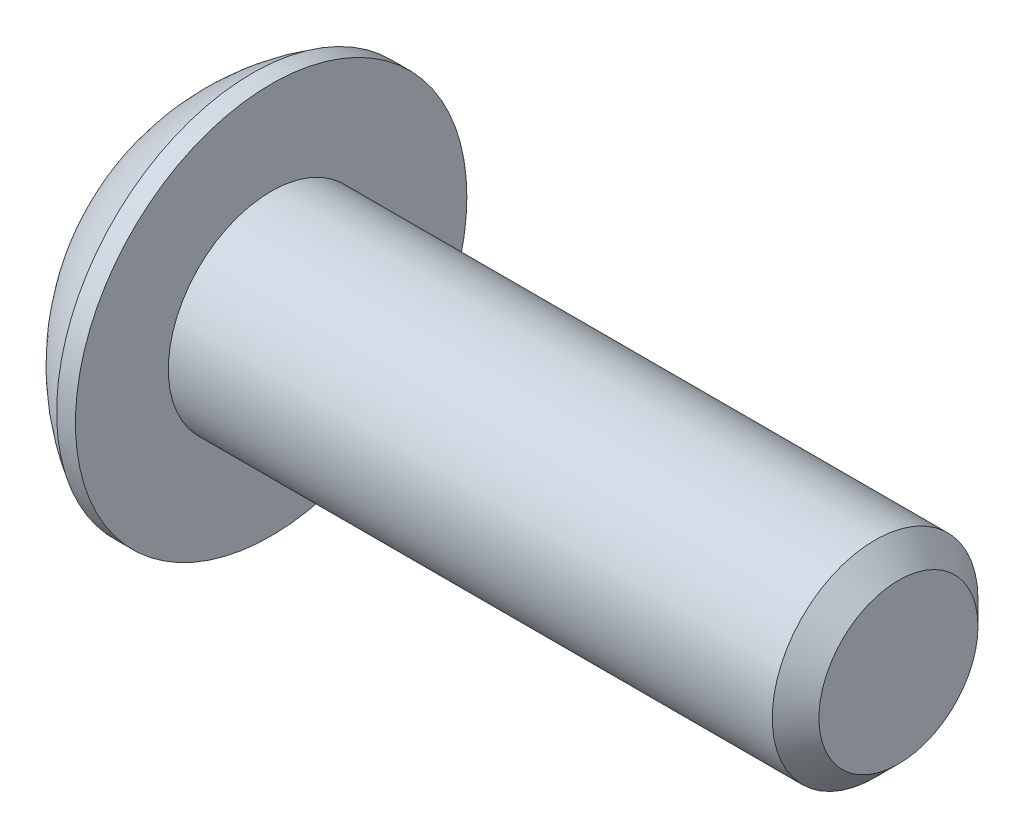
from build123d import *

# Parameters (mm, degrees)
CUT_EXTRUDE1_DEPTH = 1.3208
TAPPED_HOLE1_D     = 2.388
TAPPED_HOLE1_DEPTH = 1.32
TAPPED_HOLE1_TIP   = 0.689356221
CHAMFER1_SIZE      = 0.4724


with BuildPart() as part:
    # Sketch1 → Revolve2 (revolve)
    with BuildSketch(Plane.XY):
        with BuildLine():
            Line((7.4549, 0), (-7.4549, 0))
            Line((-7.4549, 0), (-7.4549, 1.9812))
            ThreePointArc((-7.4549, 1.9812), (-6.689453788, 3.109295804), (-5.6261, 3.9624))
            Line((-5.6261, 3.9624), (-5.2451, 3.9624))
            Line((-5.2451, 3.9624), (-5.2451, 2.0828))
            Line((-5.2451, 2.0828), (7.4549, 2.0828))
            Line((7.4549, 2.0828), (7.4549, 0))
        make_face()
    revolve(axis=Axis((7.4549, 0, 0), (-1, 0, 0)))

    # Sketch9 → Cut-Extrude1 (cut)
    with BuildSketch(Plane.ZY.offset(7.4549)):
        Polygon((0, 1.378481503), (1.1938, 0.689240751), (1.1938, -0.689240751), (0, -1.378481503), (-1.1938, -0.689240751), (-1.1938, 0.689240751), align=None)
    extrude(amount=-CUT_EXTRUDE1_DEPTH, mode=Mode.SUBTRACT)

    # Tapped Hole1
    with Locations(Plane(origin=(-7.4549, 0, 0), x_dir=(0, 0, -1), z_dir=(-1, 0, 0))):
        with Locations((0, 0)):
            Hole(TAPPED_HOLE1_D / 2, depth=TAPPED_HOLE1_DEPTH)
            with Locations((0, 0, -(TAPPED_HOLE1_DEPTH + TAPPED_HOLE1_TIP / 2))):  # 120° drill point
                Cone(0, TAPPED_HOLE1_D / 2, TAPPED_HOLE1_TIP, mode=Mode.SUBTRACT)

    # Chamfer1
    chamfer1_edges = [part.edges().sort_by_distance(p)[0] for p in [
        (7.4549, -2.0828, 0),
    ]]
    chamfer(chamfer1_edges, length=CHAMFER1_SIZE)


solid = part.part
